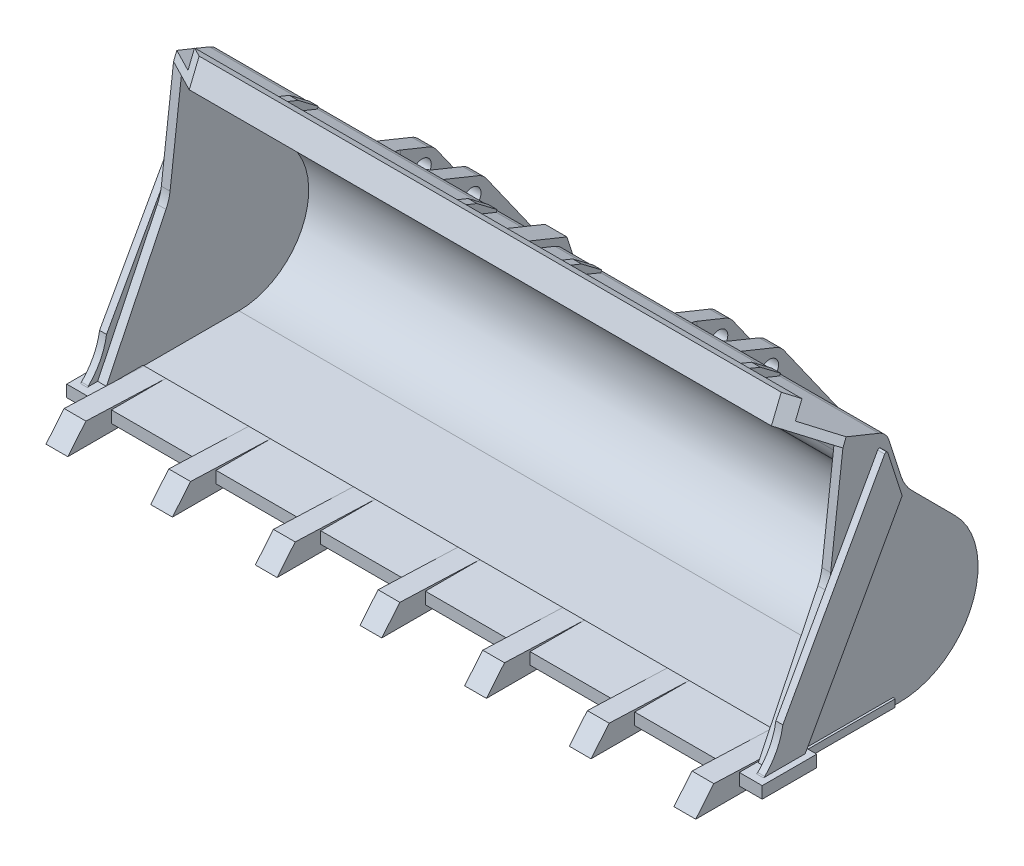
from build123d import *
from OCP.BRepFilletAPI import BRepFilletAPI_MakeChamfer

# Parameters (mm, degrees)
BOSS_EXTRUDE1_DEPTH            = 191.875
FILLET1_R                      = 25
FILLET2_R                      = 10
FILLET3_R                      = 25
SHELL1_START                   = -191.875
SHELL1_DEPTH                   = 186.875
SKETCH3_W                      = 31.25
SKETCH3_H                      = 6.75
BOSS_EXTRUDE3_DEPTH            = 199.375
SKETCH4_W                      = 51.25
SKETCH4_H                      = 4.25
BOSS_EXTRUDE4_DEPTH            = 193.125
BOSS_EXTRUDE5_DEPTH            = 4
FILLET4_R                      = 1
CUT_EXTRUDE1_REACH             = 250.973
CUT_EXTRUDE1_DIRECTION_2_DEPTH = 249.972924064
BOSS_EXTRUDE6_DEPTH            = 6.25
SKETCH8_W                      = 5
SKETCH8_H                      = 32.484911219
BOSS_EXTRUDE7_DEPTH            = 5
CHAMFER1_SIZE                  = 3.75
CHAMFER1_SIZE2                 = 13.995190528
BOSS_EXTRUDE8_DEPTH            = 104.375
CUT_EXTRUDE2_DEPTH             = 448.971463701
CUT_EXTRUDE2_DEPTH_BACK        = 448.971463701
SKETCH11_W                     = 132.5
SKETCH11_H                     = 203.705147303
CUT_EXTRUDE3_DEPTH             = 296.554158176
CUT_EXTRUDE3_DEPTH_BACK        = 296.554158176
SKETCH12_R                     = 5.25
BOSS_EXTRUDE9_DEPTH            = 6.25
LPATTERN1_COUNT                = 4
LPATTERN1_PITCH                = 60
LPATTERN1_COL_COUNT            = 4
LPATTERN1_COL_PITCH            = 60


# Read off the part's stored shape, not the designer's step: Shell1
with BuildPart() as part:
    # Sketch1 → Boss-Extrude1 (new body)
    with BuildSketch(Plane(origin=(0, 0, 0), x_dir=(0, 0, -1), z_dir=(1, 0, 0))):
        with BuildLine():
            Line((76.25, 0), (0, 0))
            Line((0, 0), (0, 5))
            Line((0, 5), (36.25, 80))
            Line((36.25, 80), (43.75, 142.5))
            Line((43.75, 142.5), (27.766260673, 148.987108533))
            Line((27.766260673, 148.987108533), (33.407224615, 162.886012296))
            Line((33.407224615, 162.886012296), (38.040192536, 161.005690982))
            Line((38.040192536, 161.005690982), (34.279549908, 151.73975514))
            Line((34.279549908, 151.73975514), (68.70063707, 137.769724493))
            Line((68.70063707, 137.769724493), (78.961662605, 106.019724493))
            Line((78.961662605, 106.019724493), (108.119807116, 76.769724493))
            ThreePointArc((108.119807116, 76.769724493), (117.811025025, 27.746559795), (76.25, 0))
        make_face()
    extrude(amount=-BOSS_EXTRUDE1_DEPTH)

    # Fillet1
    fillet1_edges = [part.edges().sort_by_distance(p)[0] for p in [
        (-95.9375, 106.019724493, -78.961662605),
    ]]
    fillet(fillet1_edges, radius=FILLET1_R)

    # Fillet2
    fillet2_edges = [part.edges().sort_by_distance(p)[0] for p in [
        (-95.9375, 137.769724493, -68.70063707),
    ]]
    fillet(fillet2_edges, radius=FILLET2_R)

    # Fillet3
    fillet3_edges = [part.edges().sort_by_distance(p)[0] for p in [
        (-95.9375, 80, -36.25),
    ]]
    fillet(fillet3_edges, radius=FILLET3_R)

    # Shell1 outline → Shell1 (cut)
    with BuildSketch(Plane.YZ.offset(SHELL1_START)):
        with BuildLine():
            Line((134.890373029, -62.499538913), (142.5, -43.75))
            Line((142.5, -43.75), (84.143356214, -36.747202746))
            ThreePointArc((84.143356214, -36.747202746), (80.097194823, -35.918036913), (76.242770216, -34.434005605))
            Line((76.242770216, -34.434005605), (5, 0))
            Line((5, 0), (5, -76.25))
            ThreePointArc((5, -76.25), (29.663608707, -113.193133355), (73.239755105, -104.578717437))
            Line((73.239755105, -104.578717437), (98.239053025, -79.657926277))
            ThreePointArc((98.239053025, -79.657926277), (103.784158848, -75.300639886), (110.193241263, -72.358224912))
            Line((110.193241263, -72.358224912), (131.79500979, -65.376924172))
            ThreePointArc((131.79500979, -65.376924172), (133.661641887, -64.281344297), (134.890373029, -62.499538913))
        make_face()
    extrude(amount=SHELL1_DEPTH, mode=Mode.SUBTRACT)

    # Sketch3 → Boss-Extrude3 (add)
    with BuildSketch(Plane.ZY.offset(191.875)):
        with Locations((-5.625, 2.125)):
            Rectangle(SKETCH3_W, SKETCH3_H)
    extrude(amount=-BOSS_EXTRUDE3_DEPTH)

    # Sketch4 → Boss-Extrude4 (add)
    with BuildSketch(Plane.ZY.offset(191.875)):
        with Locations((-46.875, 2.125)):
            Rectangle(SKETCH4_W, SKETCH4_H)
    extrude(amount=-BOSS_EXTRUDE4_DEPTH)

    # Sketch5 → Boss-Extrude5 (add)
    with BuildSketch(Plane(origin=(0, 0, 0), x_dir=(0, 0, -1), z_dir=(1, 0, 0))):
        with BuildLine():
            Line((-7, 4), (17.296273942, 4))
            Line((17.296273942, 4), (73.75848208, 105.860519848))
            Line((73.75848208, 105.860519848), (64.810109376, 133.548866626))
            Line((64.810109376, 133.548866626), (5.333376395, 26.25))
            ThreePointArc((5.333376395, 26.25), (1.167877044, 14.015722909), (-7, 4))
        make_face()
    extrude(amount=BOSS_EXTRUDE5_DEPTH)

    # Fillet4
    fillet4_edges = [part.edges().sort_by_distance(p)[0] for p in [
        (2, 5.5, 5.354578656),
        (2, 105.860519848, -73.75848208),
        (2, 133.548866626, -64.810109376),
    ]]
    fillet(fillet4_edges, radius=FILLET4_R)

    # Sketch6 → Cut-Extrude1 (cut, up to next)
    with BuildSketch(Plane(origin=(0, 142.225070506, -57.723005215), x_dir=(1, 0, 0), z_dir=(0, 0.9265935841802972, -0.37606426280080163)), mode=Mode.PRIVATE) as cut_extrude1_sk1:
        Polygon((0, -13.050688141), (0, -30.300688141), (-25, -30.300688141), align=None)
    cut_extrude1_tool1 = extrude(cut_extrude1_sk1.sketch, amount=-CUT_EXTRUDE1_REACH, mode=Mode.PRIVATE) & part.part
    add(cut_extrude1_tool1.solids().sort_by_distance((-8.333333, 151.457707, -34.974495))[0], mode=Mode.SUBTRACT)

    # Sketch6 → Cut-Extrude1 direction 2 (cut)
    with BuildSketch(Plane(origin=(0, 142.225070506, -57.723005215), x_dir=(1, 0, 0), z_dir=(0, 0.9265935841802972, -0.37606426280080163))):
        Polygon((0, -13.050688141), (0, -30.300688141), (-25, -30.300688141), align=None)
    extrude(amount=CUT_EXTRUDE1_DIRECTION_2_DEPTH, mode=Mode.SUBTRACT)

    # Sketch7 → Boss-Extrude6 (add)
    with BuildSketch(Plane.ZY.offset(191.875)):
        with BuildLine():
            Line((-79.377558746, 115.30123122), (-76.285049473, 114.301788177))
            Line((-76.285049473, 114.301788177), (-70.134630746, 133.332614472))
            ThreePointArc((-70.134630746, 133.332614472), (-67.943470995, 137.065878666), (-64.379860227, 139.52334095))
            Line((-64.379860227, 139.52334095), (-45.847988543, 147.044626206))
            Line((-45.847988543, 147.044626206), (-47.258229528, 150.519352147))
            Line((-47.258229528, 150.519352147), (-71.126378362, 140.832302777))
            Line((-71.126378362, 140.832302777), (-79.377558746, 115.30123122))
        make_face()
    extrude(amount=-BOSS_EXTRUDE6_DEPTH)

    # Sketch8 → Boss-Extrude7 (add)
    with BuildSketch(Plane(origin=(0, 142.225070506, -57.723005215), x_dir=(1, 0, 0), z_dir=(0, 0.9265935841802972, -0.37606426280080163))):
        with Locations((-161.875, -9.058232531)):
            Rectangle(SKETCH8_W, SKETCH8_H)
        with Locations((-59.375, -9.058232531)):
            Rectangle(SKETCH8_W, SKETCH8_H)
    extrude(amount=BOSS_EXTRUDE7_DEPTH)

    # Chamfer1: one chamfer whose edges measure the first distance from different faces: ONE call of the kernel's chamfer builder (chamfer() names one face for all edges)
    chamfer1_edges_1 = [part.edges().sort_by_distance(p)[0] for p in [
        (-161.875, 144.156308871, -66.260181541),
    ]]
    chamfer1_side_1 = [part.faces().sort_by_distance(p)[0] for p in [
        (-161.875, 141.839824911, -65.320020884),
    ]]
    chamfer1_edges_2 = [part.edges().sort_by_distance(p)[0] for p in [
        (-59.375, 144.156308871, -66.260181541),
    ]]
    chamfer1_side_2 = [part.faces().sort_by_distance(p)[0] for p in [
        (-59.375, 141.839824911, -65.320020884),
    ]]
    chamfer1 = BRepFilletAPI_MakeChamfer(part.part.solid().wrapped)
    for e in chamfer1_edges_1:
        chamfer1.Add(CHAMFER1_SIZE, CHAMFER1_SIZE2, e.wrapped, chamfer1_side_1[0].wrapped)  # the first distance lies on this face
    for e in chamfer1_edges_2:
        chamfer1.Add(CHAMFER1_SIZE, CHAMFER1_SIZE2, e.wrapped, chamfer1_side_2[0].wrapped)  # the first distance lies on this face
    add(Compound.cast(chamfer1.Shape()), mode=Mode.REPLACE)

    # Mirror1: part across plane


with BuildPart() as part_1:
    add(part.part)
    add(part.part.mirror(Plane(origin=(-191.875, 45, -76.25), x_dir=(0, 0, 1), z_dir=(-1, 0, 0))))


with BuildPart() as body_2:
    # Sketch10 → Boss-Extrude8 (new, symmetric)
    with BuildSketch(Plane(origin=(-191.875, 0, 0), x_dir=(0, 0, -1), z_dir=(1, 0, 0))):
        with BuildLine():
            Line((21.25, -0.625), (137.655147303, -0.625))
            ThreePointArc((137.655147303, -0.625), (143.306145682, 1.943852331), (145.086055964, 7.890675379))
            Line((145.086055964, 7.890675379), (138.274542404, 57.725234892))
            ThreePointArc((138.274542404, 57.725234892), (136.763528623, 63.506641244), (133.923687851, 68.764314345))
            Line((133.923687851, 68.764314345), (97.307063687, 120.596996455))
            ThreePointArc((97.307063687, 120.596996455), (95.354508423, 122.661287431), (92.900169922, 124.093066677))
            Line((92.900169922, 124.093066677), (70.134630746, 133.332614472))
            Line((70.134630746, 133.332614472), (77.115931486, 111.730845945))
            ThreePointArc((77.115931486, 111.730845945), (79.567943964, 106.389943932), (83.199015957, 101.769022413))
            Line((83.199015957, 101.769022413), (108.119807116, 76.769724493))
            ThreePointArc((108.119807116, 76.769724493), (117.811025025, 27.746559795), (76.25, 0))
            Line((76.25, 0), (72.5, 0))
            Line((72.5, 0), (21.25, 0))
            Line((21.25, 0), (21.25, -0.625))
        make_face()
    extrude(amount=BOSS_EXTRUDE8_DEPTH, both=True)

    # Sketch11 → Cut-Extrude2 (cut, two sides: drawn at the far end of the back side and taken through both)
    with BuildSketch(Plane(origin=(0, 0, 0), x_dir=(1, 0, 0), z_dir=(0, 1, 0)).offset(-CUT_EXTRUDE2_DEPTH_BACK)):
        with BuildLine():
            Line((-267.125, 203.705147303), (-286.625, 203.705147303))
            Line((-286.625, 203.705147303), (-286.625, 76.87692225))
            ThreePointArc((-286.625, 76.87692225), (-276.874999039, 67.126924172), (-267.125, 76.876924172))
            Line((-267.125, 76.876924172), (-267.125, 203.705147303))
        make_face()
        with Locations((-191.875, 101.852573652)):
            Rectangle(SKETCH11_W, SKETCH11_H)
        with BuildLine():
            Line((-116.625, 76.876924172), (-116.625, 203.705147303))
            Line((-116.625, 203.705147303), (-97.125, 203.705147303))
            Line((-97.125, 203.705147303), (-97.125, 76.876924172))
            ThreePointArc((-97.125, 76.876924172), (-106.875, 67.126924172), (-116.625, 76.876924172))
        make_face()
    extrude(amount=CUT_EXTRUDE2_DEPTH + CUT_EXTRUDE2_DEPTH_BACK, mode=Mode.SUBTRACT)


with BuildPart() as cut_extrude2_piece_1:
    # of the separate pieces the step leaves, piece 1, a body of its own (cut_extrude2_pieces)
    add(body_2.part.solids().sort_by_distance((-87.5, -0.625, -21.25))[0])


with BuildPart() as cut_extrude2_piece_2:
    # of the separate pieces the step leaves, piece 2, a body of its own (cut_extrude2_pieces)
    add(body_2.part.solids().sort_by_distance((-258.125, -0.625, -21.25))[0])


with BuildPart() as cut_extrude3_tool:
    # Sketch12 → Cut-Extrude3 (new, two sides: drawn at the far end of the back side and taken through both)
    with BuildSketch(Plane(origin=(-191.875, 0, 0), x_dir=(0, 0, -1), z_dir=(1, 0, 0)).offset(-CUT_EXTRUDE3_DEPTH_BACK)):
        with Locations((137.655147303, 6.875)):
            Circle(SKETCH12_R)
        with Locations((89.139527294, 114.827130835)):
            Circle(SKETCH12_R)
    extrude(amount=CUT_EXTRUDE3_DEPTH + CUT_EXTRUDE3_DEPTH_BACK)


with BuildPart() as cut_extrude2_piece_1_1:
    add(cut_extrude2_piece_1.part)

    # Cut-Extrude3: cut by cut_extrude3_tool
    add(cut_extrude3_tool.part, mode=Mode.SUBTRACT)


with BuildPart() as cut_extrude2_piece_2_1:
    add(cut_extrude2_piece_2.part)

    # Cut-Extrude3: cut by cut_extrude3_tool
    add(cut_extrude3_tool.part, mode=Mode.SUBTRACT)


with BuildPart() as part_2:
    add(part_1.part)

    # Combine1: union Cut-Extrude2 piece 1, Cut-Extrude2 piece 2
    add(cut_extrude2_piece_1_1.part)
    add(cut_extrude2_piece_2_1.part)

    # Sketch13 → Boss-Extrude9 (add, symmetric)
    with BuildSketch(Plane(origin=(-191.875, 0, 0), x_dir=(0, 0, -1), z_dir=(1, 0, 0))):
        Polygon((21.25, 5.5), (18.75, -1.25), (18.75, -5.25), (-35, -5.25), (-24.616720171, 7.25), align=None)
    boss_extrude9 = extrude(amount=BOSS_EXTRUDE9_DEPTH, both=True)

    # LPattern1: Boss-Extrude9 ×4
    with Locations(*[(-i * LPATTERN1_PITCH, 0, 0) for i in range(1, LPATTERN1_COUNT)]):
        add(boss_extrude9)

    # LPattern1 col: Boss-Extrude9 ×4
    with Locations(*[(i * LPATTERN1_COL_PITCH, 0, 0) for i in range(1, LPATTERN1_COL_COUNT)]):
        add(boss_extrude9)


solid = part_2.part
